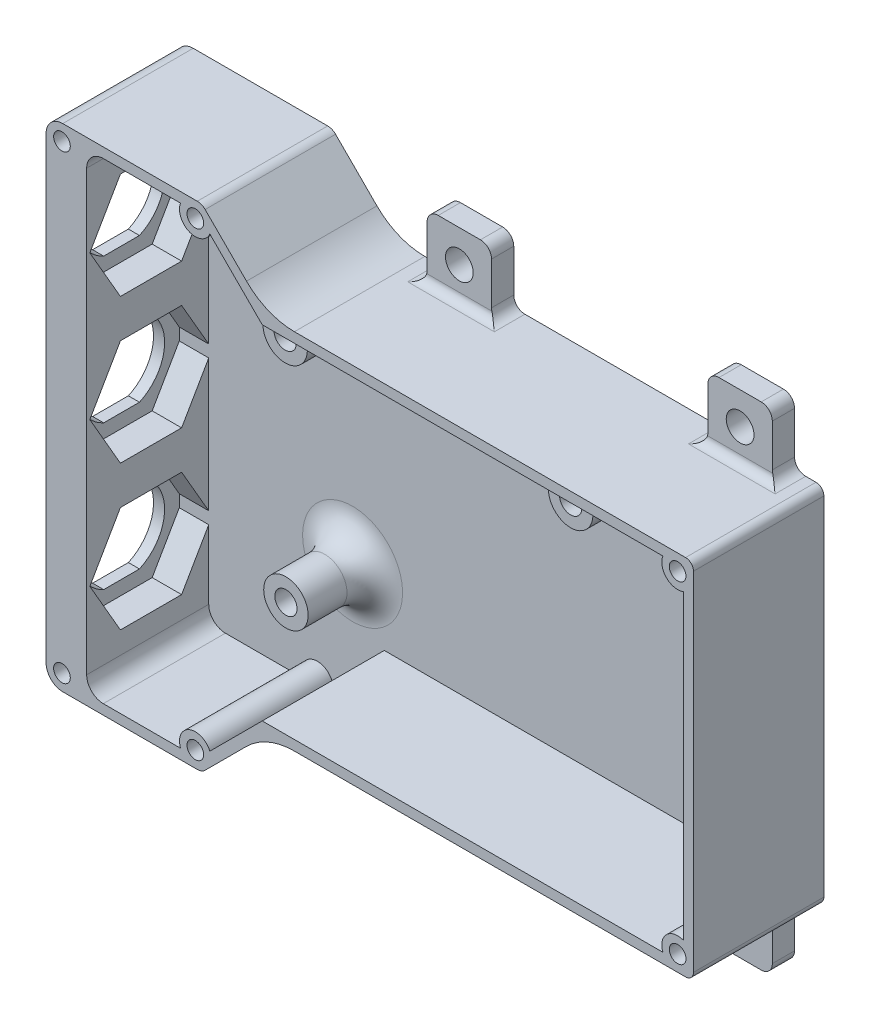
from build123d import *

# Parameters (mm, degrees)
BOSS_EXTRUDE1_DEPTH  = 36.78
BOSS_EXTRUDE2_DEPTH  = 3.5
SKETCH4_W            = 33.28
SKETCH4_H            = 85
BOSS_EXTRUDE3_DEPTH  = 2
BOSS_EXTRUDE4_DEPTH  = 5.3
SKETCH6_W            = 182.812025346
SKETCH6_H            = 122.444648275
CUT_EXTRUDE1_DEPTH   = 4
FILLET4_R            = 10
SKETCH8_W            = 4
SKETCH8_H            = 61.785
CUT_EXTRUDE2_DEPTH   = 29.28
BOSS_EXTRUDE6_DEPTH  = 11
SKETCH10_W           = 4
SKETCH10_H           = 61.785
BOSS_EXTRUDE7_DEPTH  = 29.28
BOSS_EXTRUDE10_DEPTH = 29.28
CUT_EXTRUDE12_DEPTH  = 157.105396255
CUT_EXTRUDE13_DEPTH  = 157.105396255
CUT_EXTRUDE14_START  = -2
CUT_EXTRUDE14_DEPTH  = 2
FILLET26_R           = 3
FILLET27_R           = 3
FILLET28_R           = 2
SKETCH33_R           = 2.853
BOSS_EXTRUDE13_DEPTH = 29.28
SKETCH34_R           = 1.5
CUT_EXTRUDE15_DEPTH  = 20
FILLET29_R           = 1.425
CUT_EXTRUDE16_DEPTH  = 17.28
SKETCH36_W           = 144.672461611
SKETCH36_H           = 109.674078272
CUT_EXTRUDE17_DEPTH  = 7.3
SKETCH38_R           = 4
SKETCH38_R_2         = 2
BOSS_EXTRUDE14_DEPTH = 12
FILLET30_R           = 5
SKETCH39_W           = 11.6
SKETCH39_H           = 11.6
SKETCH39_R           = 2.5
BOSS_EXTRUDE15_DEPTH = 4
FILLET31_R           = 2
FILLET32_R           = 1.5


with BuildPart() as part:
    # Sketch1 → Boss-Extrude1 (new body)
    with BuildSketch(Plane.XY):
        Polygon((21.656854249, -104.269599188), (33.266854249, -92.659599188), (100.455, -92.659599188), (100.455, -22.874599188), (33.261854249, -22.874599188), (21.656854249, -11.269599188), (1.656854249, -11.269599188), (-18.3, -11.269599188), (-18.3, -15.269599188), (0, -15.269599188), (20, -15.269599188), (31.605, -26.874599188), (96.455, -26.874599188), (96.455, -88.659599188), (31.61, -88.659599188), (20, -100.269599188), (0, -100.269599188), (-18.3, -100.269599188), (-18.3, -104.269599188), (1.656854249, -104.269599188), align=None)
    extrude(amount=BOSS_EXTRUDE1_DEPTH)

    # Sketch2 → Boss-Extrude2 (add)
    with BuildSketch(Plane(origin=(0, 0, 0), x_dir=(-1, 0, 0), z_dir=(0, 0, -1))):
        Polygon((18.3, -15.269599188), (18.3, -100.269599188), (18.3, -104.269599188), (-21.656854249, -104.269599188), (-33.266854249, -92.659599188), (-100.455, -92.659599188), (-100.455, -22.874599188), (-33.261854249, -22.874599188), (-21.656854249, -11.269599188), (18.3, -11.269599188), align=None)
    extrude(amount=-BOSS_EXTRUDE2_DEPTH)

    # Sketch4 → Boss-Extrude3 (add)
    # profile 1 of 2: a face of its own
    with BuildSketch(Plane(origin=(-5.3, 0, 0), x_dir=(0, 0, -1), z_dir=(1, 0, 0))):
        with Locations((-20.14, -57.769599188)):
            Rectangle(SKETCH4_W, SKETCH4_H)
        with BuildLine():
            ThreePointArc((-10.673609458, -90.819599188), (-6.142304845, -83.769599188), (-10.673609458, -76.719599188))
            Line((-10.673609458, -76.719599188), (-13.892304845, -76.719599188))
            Line((-13.892304845, -76.719599188), (-17.111000233, -76.719599188))
            ThreePointArc((-17.111000233, -76.719599188), (-21.642304845, -83.769599188), (-17.111000233, -90.819599188))
            Line((-17.111000233, -90.819599188), (-13.892304845, -90.819599188))
            Line((-13.892304845, -90.819599188), (-10.673609458, -90.819599188))
        make_face(mode=Mode.SUBTRACT)
        with BuildLine():
            ThreePointArc((-10.673609458, -64.819599188), (-6.142304845, -57.769599188), (-10.673609458, -50.719599188))
            Line((-10.673609458, -50.719599188), (-13.892304845, -50.719599188))
            Line((-13.892304845, -50.719599188), (-17.111000233, -50.719599188))
            ThreePointArc((-17.111000233, -50.719599188), (-21.642304845, -57.769599188), (-17.111000233, -64.819599188))
            Line((-17.111000233, -64.819599188), (-13.892304845, -64.819599188))
            Line((-13.892304845, -64.819599188), (-10.673609458, -64.819599188))
        make_face(mode=Mode.SUBTRACT)
        with BuildLine():
            ThreePointArc((-10.673609458, -38.819599188), (-6.142304845, -31.769599188), (-10.673609458, -24.719599188))
            Line((-10.673609458, -24.719599188), (-13.892304845, -24.719599188))
            Line((-13.892304845, -24.719599188), (-17.111000233, -24.719599188))
            ThreePointArc((-17.111000233, -24.719599188), (-21.642304845, -31.769599188), (-17.111000233, -38.819599188))
            Line((-17.111000233, -38.819599188), (-13.892304845, -38.819599188))
            Line((-13.892304845, -38.819599188), (-10.673609458, -38.819599188))
        make_face(mode=Mode.SUBTRACT)
        with BuildLine():
            Line((-21.5450814, -64.519599188), (-18.392304845, -64.519599188))
            ThreePointArc((-18.392304845, -64.519599188), (-25.142304845, -57.769599188), (-18.392304845, -51.019599188))
            Line((-18.392304845, -51.019599188), (-21.5450814, -51.019599188))
            ThreePointArc((-21.5450814, -51.019599188), (-25.842304845, -57.769599188), (-21.5450814, -64.519599188))
        make_face(mode=Mode.SUBTRACT)
    # profile 2 of 2: a face of its own
    with BuildSketch(Plane(origin=(-5.3, 0, 0), x_dir=(0, 0, -1), z_dir=(1, 0, 0))):
        with BuildLine():
            ThreePointArc((-21.5450814, -51.019599188), (-25.842304845, -57.769599188), (-21.5450814, -64.519599188))
            Line((-21.5450814, -64.519599188), (-18.392304845, -64.519599188))
            ThreePointArc((-18.392304845, -64.519599188), (-25.142304845, -57.769599188), (-18.392304845, -51.019599188))
            Line((-18.392304845, -51.019599188), (-21.5450814, -51.019599188))
        make_face()
    extrude(amount=-BOSS_EXTRUDE3_DEPTH)

    # Sketch5 → Boss-Extrude4 (add)
    with BuildSketch(Plane(origin=(-5.3, 0, 0), x_dir=(0, 0, -1), z_dir=(1, 0, 0))):
        Polygon((-19.401965798, -93.31261189), (-24.91162675, -83.769599188), (-19.401965798, -74.226586486), (-8.382643893, -74.226586486), (-3.5, -82.683573784), (-3.5, -58.855624592), (-8.382643893, -67.31261189), (-19.401965798, -67.31261189), (-24.91162675, -57.769599188), (-19.401965798, -48.226586486), (-8.382643893, -48.226586486), (-3.5, -56.683573784), (-3.5, -32.855624592), (-8.382643893, -41.31261189), (-19.401965798, -41.31261189), (-24.91162675, -31.769599188), (-19.401965798, -22.226586486), (-8.382643893, -22.226586486), (-3.5, -30.683573784), (-3.5, -15.269599188), (-36.78, -15.269599188), (-36.78, -100.269599188), (-3.5, -100.269599188), (-3.5, -84.855624592), (-8.382643893, -93.31261189), align=None)
    extrude(amount=BOSS_EXTRUDE4_DEPTH)

    # Sketch6 → Cut-Extrude1 (cut)
    with BuildSketch(Plane.XY.offset(36.78)):
        with Locations((42.431756464, -61.222324138)):
            Rectangle(SKETCH6_W, SKETCH6_H)
    extrude(amount=-CUT_EXTRUDE1_DEPTH, mode=Mode.SUBTRACT)

    # Fillet4
    fillet4_edges = [part.edges().sort_by_distance(p)[0] for p in [
        (33.266854249, -92.659599188, 16.39),
        (33.261854249, -22.874599188, 16.39),
    ]]
    fillet(fillet4_edges, radius=FILLET4_R)

    # Sketch8 → Cut-Extrude2 (cut)
    with BuildSketch(Plane.XY.offset(32.78)):
        with Locations((98.455, -57.767099188)):
            Rectangle(SKETCH8_W, SKETCH8_H)
    extrude(amount=-CUT_EXTRUDE2_DEPTH, mode=Mode.SUBTRACT)

    # Sketch9 → Boss-Extrude6 (add)
    with BuildSketch(Plane(origin=(100.455, 0, 0), x_dir=(0, 0, -1), z_dir=(1, 0, 0))):
        Polygon((-32.78, -92.659599188), (-32.78, -88.659599188), (-3.5, -88.659599188), (-3.5, -26.874599188), (-32.78, -26.874599188), (-32.78, -22.874599188), (0, -22.874599188), (0, -92.659599188), align=None)
    extrude(amount=BOSS_EXTRUDE6_DEPTH)

    # Sketch10 → Boss-Extrude7 (add)
    with BuildSketch(Plane.XY.offset(32.78)):
        with Locations((109.455, -57.767099188)):
            Rectangle(SKETCH10_W, SKETCH10_H)
    extrude(amount=-BOSS_EXTRUDE7_DEPTH)

    # Sketch24 → Boss-Extrude10 (add)
    with BuildSketch(Plane.XY.offset(32.78)):
        Polygon((107.455, -88.659599188), (107.455, -85.659599188), (104.455, -88.659599188), align=None)
        Polygon((107.455, -26.874599188), (104.455, -26.874599188), (107.455, -29.874599188), align=None)
    extrude(amount=-BOSS_EXTRUDE10_DEPTH)

    # Sketch28 → Cut-Extrude12 (cut, through all)
    with BuildSketch(Plane.XY.offset(32.78)):
        Polygon((-7.3, -83.769599188), (-7.3, -31.769599188), (-7.3, -6.24885996), (-26.34551371, -6.24885996), (-26.34551371, -107.703120658), (-7.3, -107.703120658), align=None)
    extrude(amount=-CUT_EXTRUDE12_DEPTH, mode=Mode.SUBTRACT)

    # Sketch29 → Cut-Extrude13 (cut, through all)
    with BuildSketch(Plane.XY.offset(32.78)):
        with BuildLine():
            Line((-7.3, -104.269599188), (21.656854249, -104.269599188))
            Line((21.656854249, -104.269599188), (30.337922061, -95.588531376))
            ThreePointArc((30.337922061, -95.588531376), (33.58215555, -93.420803863), (37.408989873, -92.659599188))
            Line((37.408989873, -92.659599188), (111.455, -92.659599188))
            Line((111.455, -92.659599188), (111.455, -22.874599188))
            Line((111.455, -22.874599188), (37.403989873, -22.874599188))
            ThreePointArc((37.403989873, -22.874599188), (33.57715555, -22.113394513), (30.332922061, -19.945667))
            Line((30.332922061, -19.945667), (21.656854249, -11.269599188))
            Line((21.656854249, -11.269599188), (-7.3, -11.269599188))
            Line((-7.3, -11.269599188), (-7.3, -13.465599188))
            Line((-7.3, -13.465599188), (20.747241267, -13.465599188))
            Line((20.747241267, -13.465599188), (28.78011557, -21.498473491))
            ThreePointArc((28.78011557, -21.498473491), (32.736782732, -24.142233967), (37.403989873, -25.070599188))
            Line((37.403989873, -25.070599188), (109.259, -25.070599188))
            Line((109.259, -25.070599188), (109.259, -90.463599188))
            Line((109.259, -90.463599188), (37.408989873, -90.463599188))
            ThreePointArc((37.408989873, -90.463599188), (32.741782732, -91.39196441), (28.78511557, -94.035724885))
            Line((28.78511557, -94.035724885), (20.747241267, -102.073599188))
            Line((20.747241267, -102.073599188), (-7.3, -102.073599188))
            Line((-7.3, -102.073599188), (-7.3, -104.269599188))
        make_face()
    extrude(amount=-CUT_EXTRUDE13_DEPTH, mode=Mode.SUBTRACT)

    # Sketch30 → Cut-Extrude14 (cut)
    with BuildSketch(Plane(origin=(0, 0, 0), x_dir=(-1, 0, 0), z_dir=(0, 0, -1)).offset(CUT_EXTRUDE14_START)):
        with BuildLine():
            Line((-109.259, -25.070599188), (-109.259, -90.463599188))
            Line((-109.259, -90.463599188), (-37.408989873, -90.463599188))
            ThreePointArc((-37.408989873, -90.463599188), (-32.741782732, -91.39196441), (-28.78511557, -94.035724885))
            Line((-28.78511557, -94.035724885), (-20.747241267, -102.073599188))
            Line((-20.747241267, -102.073599188), (7.3, -102.073599188))
            Line((7.3, -102.073599188), (7.3, -13.465599188))
            Line((7.3, -13.465599188), (-20.747241267, -13.465599188))
            Line((-20.747241267, -13.465599188), (-28.78011557, -21.498473491))
            ThreePointArc((-28.78011557, -21.498473491), (-32.736782732, -24.142233967), (-37.403989873, -25.070599188))
            Line((-37.403989873, -25.070599188), (-109.259, -25.070599188))
        make_face()
    extrude(amount=CUT_EXTRUDE14_DEPTH, mode=Mode.SUBTRACT)

    # Fillet26
    fillet26_edges = [part.edges().sort_by_distance(p)[0] for p in [
        (-7.3, -13.465599188, 17.39),
        (-7.3, -102.073599188, 17.39),
    ]]
    fillet(fillet26_edges, radius=FILLET26_R)

    # Fillet27
    fillet27_edges = [part.edges().sort_by_distance(p)[0] for p in [
        (0, -100.269599188, 18.14),
        (0, -15.269599188, 18.14),
    ]]
    fillet(fillet27_edges, radius=FILLET27_R)

    # Fillet28
    fillet28_edges = [part.edges().sort_by_distance(p)[0] for p in [
        (20, -100.269599188, 18.14),
        (20, -15.269599188, 18.14),
        (20.747241267, -13.465599188, 17.39),
        (20.747241267, -102.073599188, 17.39),
    ]]
    fillet(fillet28_edges, radius=FILLET28_R)

    # Sketch33 → Boss-Extrude13 (add)
    with BuildSketch(Plane.XY.offset(32.78)):
        with Locations((106.406, -27.923599188)):
            Circle(SKETCH33_R)
        with Locations((106.406, -87.610599188)):
            Circle(SKETCH33_R)
        with Locations((19.565489973, -99.220599188)):
            Circle(SKETCH33_R)
        with Locations((19.565489973, -16.318599188)):
            Circle(SKETCH33_R)
    extrude(amount=-BOSS_EXTRUDE13_DEPTH)

    # Sketch34 → Cut-Extrude15 (cut)
    with BuildSketch(Plane.XY.offset(32.78)):
        with Locations((-4.447, -16.318599188)):
            Circle(SKETCH34_R)
        with Locations((19.565489973, -16.318599188)):
            Circle(SKETCH34_R)
        with Locations((106.406, -27.923599188)):
            Circle(SKETCH34_R)
        with Locations((106.406, -87.610599188)):
            Circle(SKETCH34_R)
        with Locations((19.565489973, -99.220599188)):
            Circle(SKETCH34_R)
        with Locations((-4.447, -99.220599188)):
            Circle(SKETCH34_R)
    extrude(amount=-CUT_EXTRUDE15_DEPTH, mode=Mode.SUBTRACT)

    # Fillet29
    fillet29_edges = [part.edges().sort_by_distance(p)[0] for p in [
        (109.259, -25.070599188, 17.39),
        (109.259, -90.463599188, 17.39),
    ]]
    fillet(fillet29_edges, radius=FILLET29_R)

    # Sketch35 → Cut-Extrude16 (cut)
    with BuildSketch(Plane.XY.offset(20.78)):
        Polygon((31.61, -88.659599188), (103.75284942, -88.659599188), (107.455, -88.659599188), (107.455, -84.957448608), (107.455, -30.576749768), (107.455, -26.874599188), (103.75284942, -26.874599188), (31.605, -26.874599188), align=None)
    extrude(amount=-CUT_EXTRUDE16_DEPTH, mode=Mode.SUBTRACT)

    # Sketch36 → Cut-Extrude17 (cut)
    with BuildSketch(Plane.XY.offset(32.78)):
        with Locations((49.633624866, -57.488863493)):
            Rectangle(SKETCH36_W, SKETCH36_H)
    extrude(amount=-CUT_EXTRUDE17_DEPTH, mode=Mode.SUBTRACT)

    # Sketch38 → Boss-Extrude14 (add)
    # profile 1 of 4: a face of its own
    with BuildSketch(Plane.XY.offset(3.5)):
        with Locations(Location((102.7085, -78.023599188, 0), (0, 0, 180))):
            Circle(SKETCH38_R)
        with Locations(Location((102.7085, -78.023599188, 0), (0, 0, 90))):
            Circle(SKETCH38_R_2, mode=Mode.SUBTRACT)
    # profile 2 of 4: a face of its own
    with BuildSketch(Plane.XY.offset(3.5)):
        with Locations(Location((25.8989, -78.023599188, 0), (0, 0, 180))):
            Circle(SKETCH38_R)
        with Locations(Location((25.8989, -78.023599188, 0), (0, 0, 90))):
            Circle(SKETCH38_R_2, mode=Mode.SUBTRACT)
    # profile 3 of 4: a face of its own
    with BuildSketch(Plane.XY.offset(3.5)):
        with Locations(Location((25.7592, -36.748599188, 0), (0, 0, 180))):
            Circle(SKETCH38_R)
        with Locations(Location((25.7592, -36.748599188, 0), (0, 0, 90))):
            Circle(SKETCH38_R_2, mode=Mode.SUBTRACT)
    # profile 4 of 4: a face of its own
    with BuildSketch(Plane.XY.offset(3.5)):
        with Locations(Location((77.1688, -36.748599188, 0), (0, 0, 180))):
            Circle(SKETCH38_R)
        with Locations(Location((77.1688, -36.748599188, 0), (0, 0, 90))):
            Circle(SKETCH38_R_2, mode=Mode.SUBTRACT)
    extrude(amount=BOSS_EXTRUDE14_DEPTH)

    # Fillet30
    # the kernel refuses this fillet: 5 mm, written as the material it adds along each edge
    with BuildSketch(Plane(origin=(102.7085, -78.023599188, 3.5), x_dir=(-1, 0, 0), z_dir=(0, 1, 0))) as fillet30_piece_1_section:
        with BuildLine():
            CenterArc((4 + FILLET30_R, FILLET30_R), FILLET30_R, 180, 90)
            Line((4, FILLET30_R), (4, 0))
            Line((4, 0), (4 + FILLET30_R, 0))
        make_face()
    fillet30_piece_1 = revolve(axis=Axis((102.7085, -78.023599188, 3.5), (0, 0, 1)), mode=Mode.PRIVATE)
    fillet30_piece_1 = split(fillet30_piece_1, bisect_by=Plane(origin=(107.455, -84.685113099, 3.618677951), z_dir=(-1, 0, 0)), keep=Keep.TOP, mode=Mode.PRIVATE)
    add(fillet30_piece_1)
    with BuildSketch(Plane(origin=(25.8989, -78.023599188, 3.5), x_dir=(-1, 0, 0), z_dir=(0, 1, 0))) as fillet30_piece_2:
        with BuildLine():
            CenterArc((4 + FILLET30_R, FILLET30_R), FILLET30_R, 180, 90)
            Line((4, FILLET30_R), (4, 0))
            Line((4, 0), (4 + FILLET30_R, 0))
        make_face()
    revolve(axis=Axis((25.8989, -78.023599188, 3.5), (0, 0, 1)))
    with BuildSketch(Plane(origin=(25.7592, -36.748599188, 3.5), x_dir=(-1, 0, 0), z_dir=(0, 1, 0))) as fillet30_piece_3:
        with BuildLine():
            CenterArc((4 + FILLET30_R, FILLET30_R), FILLET30_R, 180, 90)
            Line((4, FILLET30_R), (4, 0))
            Line((4, 0), (4 + FILLET30_R, 0))
        make_face()
    revolve(axis=Axis((25.7592, -36.748599188, 3.5), (0, 0, 1)))
    with BuildSketch(Plane(origin=(77.1688, -36.748599188, 3.5), x_dir=(-1, 0, 0), z_dir=(0, 1, 0))) as fillet30_piece_4:
        with BuildLine():
            CenterArc((4 + FILLET30_R, FILLET30_R), FILLET30_R, 180, 90)
            Line((4, FILLET30_R), (4, 0))
            Line((4, 0), (4 + FILLET30_R, 0))
        make_face()
    revolve(axis=Axis((77.1688, -36.748599188, 3.5), (0, 0, 1)))

    # Sketch39 → Boss-Extrude15 (add)
    # profile 1 of 4: a face of its own
    with BuildSketch(Plane(origin=(0, 0, 2), x_dir=(-1, 0, 0), z_dir=(0, 0, -1))):
        with Locations((-47.621875014, -19.270599188)):
            Rectangle(SKETCH39_W, SKETCH39_H)
        with Locations((-47.621875014, -19.270599188)):
            Circle(SKETCH39_R, mode=Mode.SUBTRACT)
    # profile 2 of 4: a face of its own
    with BuildSketch(Plane(origin=(0, 0, 2), x_dir=(-1, 0, 0), z_dir=(0, 0, -1))):
        with Locations((-98.174652978, -19.270599188)):
            Rectangle(SKETCH39_W, SKETCH39_H)
        with Locations((-98.174652978, -19.270599188)):
            Circle(SKETCH39_R, mode=Mode.SUBTRACT)
    # profile 3 of 4: a face of its own
    with BuildSketch(Plane(origin=(0, 0, 2), x_dir=(-1, 0, 0), z_dir=(0, 0, -1))):
        with Locations((-98.174652978, -96.263599188)):
            Rectangle(SKETCH39_W, SKETCH39_H)
        with Locations((-98.174652978, -96.263599188)):
            Circle(SKETCH39_R, mode=Mode.SUBTRACT)
    # profile 4 of 4: a face of its own
    with BuildSketch(Plane(origin=(0, 0, 2), x_dir=(-1, 0, 0), z_dir=(0, 0, -1))):
        with Locations((-47.621875014, -96.263599188)):
            Rectangle(SKETCH39_W, SKETCH39_H)
        with Locations((-47.621875014, -96.263599188)):
            Circle(SKETCH39_R, mode=Mode.SUBTRACT)
    extrude(amount=-BOSS_EXTRUDE15_DEPTH)

    # Fillet31
    fillet31_edges = [part.edges().sort_by_distance(p)[0] for p in [
        (41.821875014, -13.470599188, 4),
        (41.821875014, -25.070599188, 4),
        (53.421875014, -25.070599188, 4),
        (53.421875014, -13.470599188, 4),
        (92.374652978, -13.470599188, 4),
        (92.374652978, -25.070599188, 4),
        (103.974652978, -25.070599188, 4),
        (103.974652978, -13.470599188, 4),
        (92.374652978, -102.063599188, 4),
        (103.974652978, -102.063599188, 4),
        (103.974652978, -90.463599188, 4),
        (92.374652978, -90.463599188, 4),
        (53.421875014, -90.463599188, 4),
        (41.821875014, -90.463599188, 4),
        (41.821875014, -102.063599188, 4),
        (53.421875014, -102.063599188, 4),
    ]]
    fillet(fillet31_edges, radius=FILLET31_R)

    # Fillet32
    fillet32_edges = [part.edges().sort_by_distance(p)[0] for p in [
        (47.621875014, -25.070599188, 6),
        (98.174652978, -25.070599188, 6),
        (98.174652978, -90.463599188, 6),
        (47.621875014, -90.463599188, 6),
    ]]
    fillet(fillet32_edges, radius=FILLET32_R)


solid = part.part
